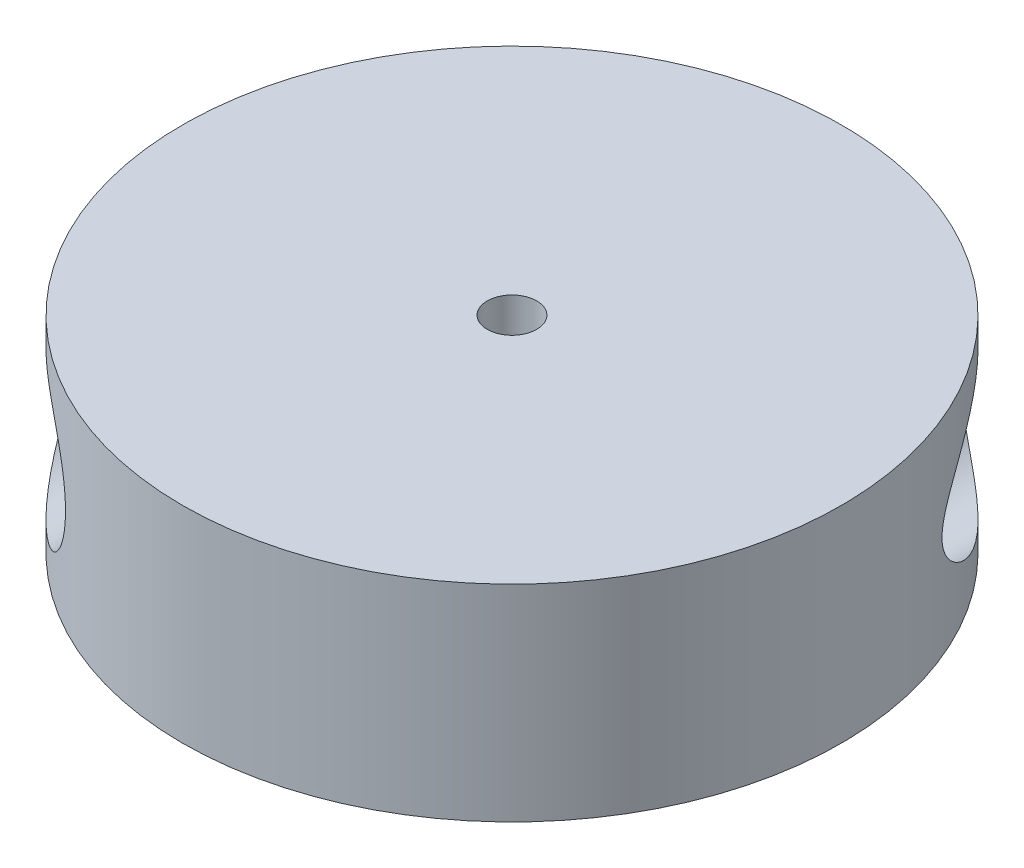
from build123d import *

# Parameters (mm, degrees)
SKETCH1_R           = 40
SKETCH1_R_2         = 3
BOSS_EXTRUDE1_DEPTH = 25
BOSS_EXTRUDE2_START = 15
SKETCH2_R           = 7
SKETCH2_R_2         = 3
BOSS_EXTRUDE2_DEPTH = 15
SKETCH3_R           = 9
CUT_EXTRUDE1_DEPTH  = 62.846584384
SKETCH4_R           = 9
CUT_EXTRUDE2_DEPTH  = 62.846584554


with BuildPart() as part:
    # Sketch1 → Boss-Extrude1 (new body)
    with BuildSketch(Plane(origin=(0, 0, 0), x_dir=(1, 0, 0), z_dir=(0, 1, 0))):
        Circle(SKETCH1_R)
        Circle(SKETCH1_R_2, mode=Mode.SUBTRACT)
    extrude(amount=BOSS_EXTRUDE1_DEPTH)

    # Sketch2 → Boss-Extrude2 (add)
    with BuildSketch(Plane.XZ.offset(BOSS_EXTRUDE2_START)):
        Circle(SKETCH2_R)
        Circle(SKETCH2_R_2, mode=Mode.SUBTRACT)
    extrude(amount=-BOSS_EXTRUDE2_DEPTH)

    # Sketch3 → Cut-Extrude1 (cut, through all)
    with BuildSketch(Plane.XY):
        with Locations((28, 12.5)):
            Circle(SKETCH3_R)
    extrude(amount=-CUT_EXTRUDE1_DEPTH, mode=Mode.SUBTRACT)

    # Sketch4 → Cut-Extrude2 (cut, through all)
    with BuildSketch(Plane.XY):
        with Locations((-28, 12.5)):
            Circle(SKETCH4_R)
    extrude(amount=CUT_EXTRUDE2_DEPTH, mode=Mode.SUBTRACT)


solid = part.part
